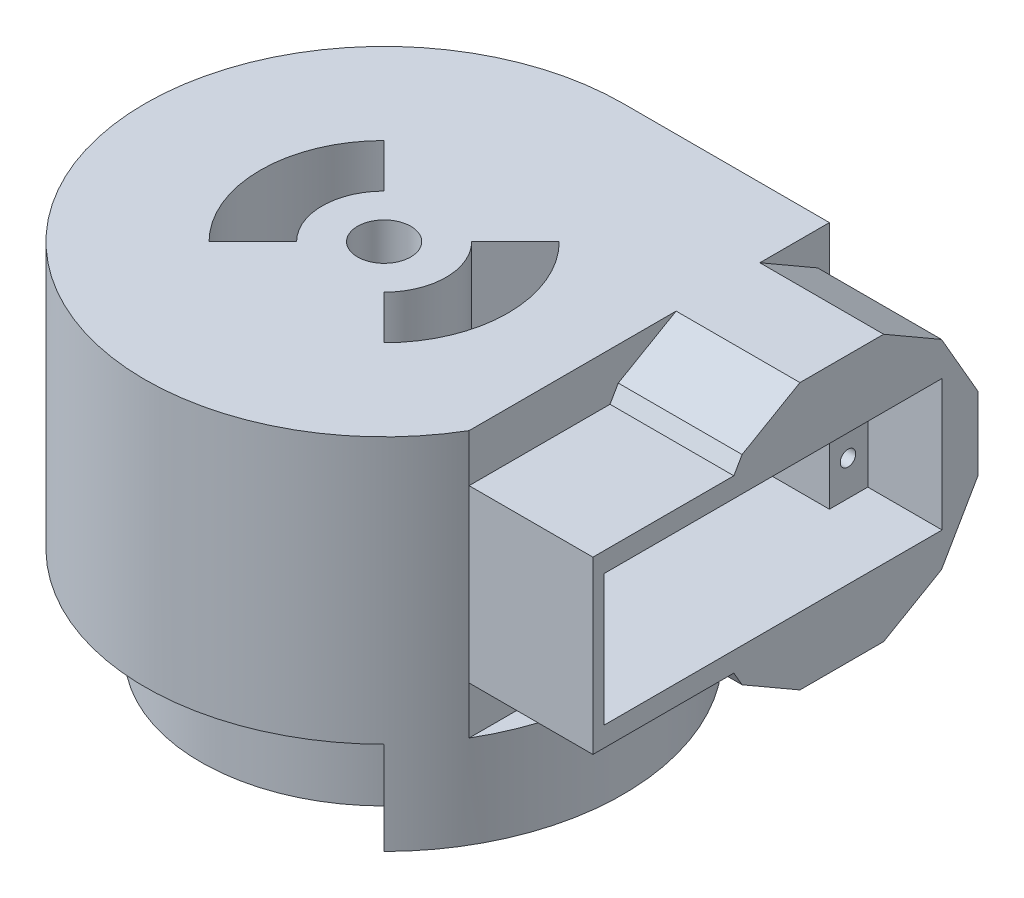
from build123d import *

# Parameters (mm, degrees)
BOSS_EXTRUDE1_DEPTH     = 43
BOSS_EXTRUDE2_START     = 15
BOSS_EXTRUDE2_DEPTH     = 15
SKETCH5_W               = 42.2
SKETCH5_H               = 21.2
CUT_EXTRUDE1_DEPTH      = 41
SKETCH5_5_W             = 6.2
SKETCH5_5_H             = 21.2
SKETCH5_5_R             = 1.25
CUT_EXTRUDE2_DEPTH      = 12
SKETCH5_6_R             = 1.25
CUT_EXTRUDE3_DEPTH      = 35
CUT_EXTRUDE4_DEPTH      = 88.729655833
CUT_EXTRUDE4_DEPTH_BACK = 88.729655833
SKETCH6_R               = 4.3
CUT_EXTRUDE5_START      = -5
SKETCH7_W               = 10
SKETCH7_H               = 6.8
CUT_EXTRUDE5_DEPTH      = 94.632977309
CUT_EXTRUDE9_DEPTH      = 20
BOSS_EXTRUDE3_DEPTH     = 53.297297


with BuildPart() as part:
    # Sketch1 → Boss-Extrude1 (new body)
    with BuildSketch(Plane(origin=(0, 0, 0), x_dir=(1, 0, 0), z_dir=(0, 1, 0))):
        with BuildLine():
            Line((0, 38.625), (53.297297188, 38.625))
            Line((53.297297188, 38.625), (53.297297188, -19.575))
            Line((53.297297188, -19.575), (33.297297188, -19.575))
            ThreePointArc((33.297297188, -19.575), (-33.525922806, -19.180800948), (0, 38.625))
        make_face()
    extrude(amount=BOSS_EXTRUDE1_DEPTH)

    # Sketch4 → Boss-Extrude2 (add)
    with BuildSketch(Plane.XZ.offset(BOSS_EXTRUDE2_START)):
        with BuildLine():
            Line((20.948038393, 20.948038393), (27.311999423, 27.311999423))
            ThreePointArc((27.311999423, 27.311999423), (38.625, 0), (27.311999423, -27.311999423))
            Line((27.311999423, -27.311999423), (20.948038393, -20.948038393))
            ThreePointArc((20.948038393, -20.948038393), (-29.625, 0), (20.948038393, 20.948038393))
        make_face()
    extrude(amount=-BOSS_EXTRUDE2_DEPTH)

    # Sketch5 → Cut-Extrude1 (cut)
    with BuildSketch(Plane(origin=(53.297297188, 0, 0), x_dir=(0, 0, -1), z_dir=(1, 0, 0))):
        with Locations((9.525, 21.5)):
            Rectangle(SKETCH5_W, SKETCH5_H)
    extrude(amount=-CUT_EXTRUDE1_DEPTH, mode=Mode.SUBTRACT)

    # Sketch5<5> → Cut-Extrude2 (cut)
    # profile 1 of 2: a face of its own
    with BuildSketch(Plane(origin=(53.297297188, 0, 0), x_dir=(0, 0, -1), z_dir=(1, 0, 0))):
        with Locations((-14.675, 21.5)):
            Rectangle(SKETCH5_5_W, SKETCH5_5_H)
        with Locations((-14.575, 16.55)):
            Circle(SKETCH5_5_R, mode=Mode.SUBTRACT)
        with Locations((-14.575, 26.45)):
            Circle(SKETCH5_5_R, mode=Mode.SUBTRACT)
    # profile 2 of 2: a face of its own
    with BuildSketch(Plane(origin=(53.297297188, 0, 0), x_dir=(0, 0, -1), z_dir=(1, 0, 0))):
        with Locations((33.725, 21.5)):
            Rectangle(SKETCH5_5_W, SKETCH5_5_H)
        with Locations((33.625, 26.45)):
            Circle(SKETCH5_5_R, mode=Mode.SUBTRACT)
        with Locations((33.625, 16.55)):
            Circle(SKETCH5_5_R, mode=Mode.SUBTRACT)
    extrude(amount=-CUT_EXTRUDE2_DEPTH, mode=Mode.SUBTRACT)

    # Sketch5<6> → Cut-Extrude3 (cut)
    with BuildSketch(Plane(origin=(53.297297188, 0, 0), x_dir=(0, 0, -1), z_dir=(1, 0, 0))):
        with Locations((33.625, 26.45)):
            Circle(SKETCH5_6_R)
        with Locations((33.625, 16.55)):
            Circle(SKETCH5_6_R)
        with Locations((-14.575, 26.45)):
            Circle(SKETCH5_6_R)
        with Locations((-14.575, 16.55)):
            Circle(SKETCH5_6_R)
    extrude(amount=-CUT_EXTRUDE3_DEPTH, mode=Mode.SUBTRACT)

    # Sketch6 → Cut-Extrude4 (cut, two sides: drawn at the far end of the back side and taken through both)
    with BuildSketch(Plane.XZ.offset(15).offset(-CUT_EXTRUDE4_DEPTH_BACK)):
        with Locations(Location((0, 0, 0), (0, 0, 270))):
            Circle(SKETCH6_R)
        with BuildLine():
            Line((7.071067812, 7.071067812), (14.142135624, 14.142135624))
            ThreePointArc((14.142135624, 14.142135624), (20, 0), (14.142135624, -14.142135624))
            Line((14.142135624, -14.142135624), (7.071067812, -7.071067812))
            ThreePointArc((7.071067812, -7.071067812), (10, 0), (7.071067812, 7.071067812))
        make_face()
        with BuildLine():
            Line((-7.071067812, -7.071067812), (-14.142135624, -14.142135624))
            ThreePointArc((-14.142135624, -14.142135624), (-20, 0), (-14.142135624, 14.142135624))
            Line((-14.142135624, 14.142135624), (-7.071067812, 7.071067812))
            ThreePointArc((-7.071067812, 7.071067812), (-10, 0), (-7.071067812, -7.071067812))
        make_face()
    extrude(amount=CUT_EXTRUDE4_DEPTH + CUT_EXTRUDE4_DEPTH_BACK, mode=Mode.SUBTRACT)

    # Sketch7 → Cut-Extrude5 (cut, through all)
    with BuildSketch(Plane(origin=(41.297297188, 0, 0), x_dir=(0, 0, -1), z_dir=(1, 0, 0)).offset(CUT_EXTRUDE5_START)):
        with Locations((30.625, 21.5)):
            Rectangle(SKETCH7_W, SKETCH7_H)
    extrude(amount=-CUT_EXTRUDE5_DEPTH, mode=Mode.SUBTRACT)

    # Sketch9 → Cut-Extrude9 (cut)
    with BuildSketch(Plane(origin=(53.297297188, 0, 0), x_dir=(0, 0, -1), z_dir=(1, 0, 0))):
        Polygon((38.625, 43), (27.385907637, 43), (36.730117767, 37.605117767), (38.625, 34.323085464), align=None)
        Polygon((4.519882233, 37.605117767), (13.864092363, 43), (-19.575, 43), (-19.575, 35.3), (3.18902187, 35.3), align=None)
        Polygon((3.18902187, 7.7), (-19.575, 7.7), (-19.575, 0), (13.864092363, 0), (4.519882233, 5.394882233), align=None)
        Polygon((38.625, 0), (38.625, 8.676914536), (36.730117767, 5.394882233), (27.385907637, 0), align=None)
    extrude(amount=-CUT_EXTRUDE9_DEPTH, mode=Mode.SUBTRACT)

    # Sketch9<7> → Boss-Extrude3 (add)
    with BuildSketch(Plane(origin=(53.297297188, 0, 0), x_dir=(0, 0, -1), z_dir=(1, 0, 0))):
        Polygon((42.625, 27.394882233), (38.625, 34.323085464), (38.625, 8.676914536), (42.625, 15.605117767), align=None)
    extrude(amount=-BOSS_EXTRUDE3_DEPTH)

    # Chamfer1
    # the kernel refuses this chamfer: 10 mm, written as the material it adds along each edge
    with BuildSketch(Plane(origin=(1.88e-07, 57.509605692, -38.625), x_dir=(-0.9905263247652732, 0, 0.13732297676281435), z_dir=(0, -1, 0))) as chamfer1_piece_1_section:
        with BuildLine():
            Line((8.273915537, 0), (-1.522844477, 9.14873215))
            Line((-1.522844477, 9.14873215), (-1.720949742, 9.121267554))
            ThreePointArc((-1.720949742, 9.121267554), (-0.834678391, 4.564210108), (-0.198105265, -0.027464595))
            Line((-0.198105265, -0.027464595), (0.027464596, -0.198105265))
            ThreePointArc((0.027464596, -0.198105265), (4.132441209, 0.148053406), (8.26005162, -0.199518901))
            Line((8.26005162, -0.199518901), (8.273915537, 0))
        make_face()
    chamfer1_piece_1 = extrude(amount=72.019211383, mode=Mode.PRIVATE)
    chamfer1_piece_1 = split(chamfer1_piece_1, bisect_by=Plane(origin=(-3.347907706, 24.181861257, -44.480038526), z_dir=(0, -0.5000000000000007, 0.8660254037844383)), keep=Keep.TOP, mode=Mode.PRIVATE)
    chamfer1_piece_1 = split(chamfer1_piece_1, bisect_by=Plane(origin=(-3.347907706, 21.5, -42.625), z_dir=(0, 0, 1)), keep=Keep.TOP, mode=Mode.PRIVATE)
    chamfer1_piece_1 = split(chamfer1_piece_1, bisect_by=Plane(origin=(-3.347907706, 18.818138743, -44.480038526), z_dir=(0, 0.5000000000000001, 0.8660254037844386)), keep=Keep.TOP, mode=Mode.PRIVATE)
    add(chamfer1_piece_1)


solid = part.part
